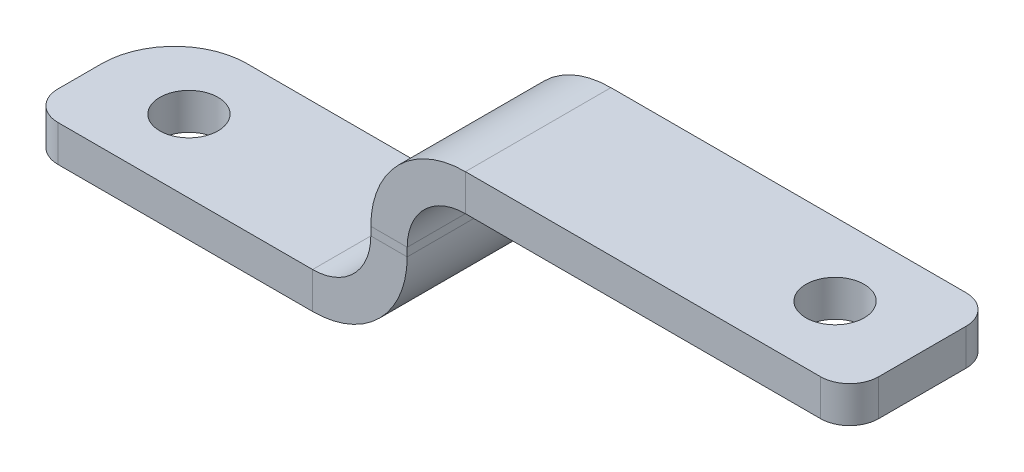
from build123d import *

# Parameters (mm, degrees)
SKETCH1_R                    = 4
BASE_FLANGE1_DEPTH           = 5
EDGE_FLANGE1_STRIP_W         = 36
EDGE_FLANGE1_STRIP_H         = 5
EDGE_FLANGE1_STRIP_CUT_DEPTH = 20
EDGE_FLANGE1_DEPTH           = 20
EDGE_FLANGE2_STRIP_W         = 36
EDGE_FLANGE2_STRIP_H         = 5
EDGE_FLANGE2_STRIP_CUT_DEPTH = 20
EDGE_FLANGE2_DEPTH           = 20
SKETCH14_R                   = 4
CUT_EXTRUDE1_DEPTH           = 10
FILLET1_R                    = 4
FILLET3_R                    = 4
FILLET4_R                    = 10


# Sheet-metal steps are written as plain solids
with BuildPart() as part:
    # Sketch1 → Base-Flange1 (new body)
    with BuildSketch(Plane(origin=(0, 0, 0), x_dir=(1, 0, 0), z_dir=(0, 1, 0))):
        Polygon((4, 10), (0, 10), (0, 6), (0, -6), (0, -10), (4, -10), (47, -10), (47, 10), align=None)
        with Locations(Location((12, 0, 0), (0, 0, 270))):
            Circle(SKETCH1_R, mode=Mode.SUBTRACT)
    extrude(amount=BASE_FLANGE1_DEPTH)

    # Edge-Flange1 strip (across the edge) → Edge-Flange1 strip cut (cut)
    with BuildSketch(Plane(origin=(47, 5, 10), x_dir=(-1, 0, 0), z_dir=(0, 0, -1))):
        with Locations((-10, -2.5)):
            Rectangle(EDGE_FLANGE1_STRIP_W, EDGE_FLANGE1_STRIP_H)
    extrude(amount=EDGE_FLANGE1_STRIP_CUT_DEPTH, mode=Mode.SUBTRACT)

    # Edge-Flange1 section (across the edge) → Edge-Flange1 (add)
    with BuildSketch(Plane(origin=(47, 5, 10), x_dir=(-1, 0, 0), z_dir=(0, 0, -1))):
        with BuildLine():
            Line((-5, 8), (-5, 17.15))
            Line((-5, 17.15), (0, 17.15))
            Line((0, 17.15), (0, 8))
            ThreePointArc((0, 8), (2.343145751, 2.343145751), (8, 0))
            Line((8, 0), (8, -5))
            ThreePointArc((8, -5), (-1.192388155, -1.192388155), (-5, 8))
        make_face()
    extrude(amount=EDGE_FLANGE1_DEPTH)

    # Edge-Flange2 strip (across the edge) → Edge-Flange2 strip cut (cut)
    with BuildSketch(Plane(origin=(52, 22.15, -10), x_dir=(0, -1, 0), z_dir=(0, 0, 1))):
        with Locations((-10, -2.5)):
            Rectangle(EDGE_FLANGE2_STRIP_W, EDGE_FLANGE2_STRIP_H)
    extrude(amount=EDGE_FLANGE2_STRIP_CUT_DEPTH, mode=Mode.SUBTRACT)

    # Edge-Flange2 section (across the edge) → Edge-Flange2 (add)
    with BuildSketch(Plane(origin=(52, 22.15, -10), x_dir=(0, -1, 0), z_dir=(0, 0, 1))):
        with BuildLine():
            Line((-5, 8), (-5, 60.81))
            Line((-5, 60.81), (0, 60.81))
            Line((0, 60.81), (0, 8))
            ThreePointArc((0, 8), (2.343145751, 2.343145751), (8, 0))
            Line((8, 0), (8, -5))
            ThreePointArc((8, -5), (-1.192388155, -1.192388155), (-5, 8))
        make_face()
    extrude(amount=EDGE_FLANGE2_DEPTH)

    # Sketch14 → Cut-Extrude1 (cut)
    with BuildSketch(Plane(origin=(0, 27.15, 0), x_dir=(1, 0, 0), z_dir=(0, 1, 0))):
        with Locations(Location((100.81, 0, 0), (0, 0, 180))):
            Circle(SKETCH14_R)
    extrude(amount=-CUT_EXTRUDE1_DEPTH, mode=Mode.SUBTRACT)

    # Fillet1
    fillet1_edges = [part.edges().sort_by_distance(p)[0] for p in [
        (112.81, 24.65, -10),
        (112.81, 24.65, 10),
    ]]
    fillet(fillet1_edges, radius=FILLET1_R)

    # Fillet3
    fillet3_edges = [part.edges().sort_by_distance(p)[0] for p in [
        (0, 2.5, 10),
    ]]
    fillet(fillet3_edges, radius=FILLET3_R)

    # Fillet4
    fillet4_edges = [part.edges().sort_by_distance(p)[0] for p in [
        (0, 2.5, -10),
    ]]
    fillet(fillet4_edges, radius=FILLET4_R)


solid = part.part
